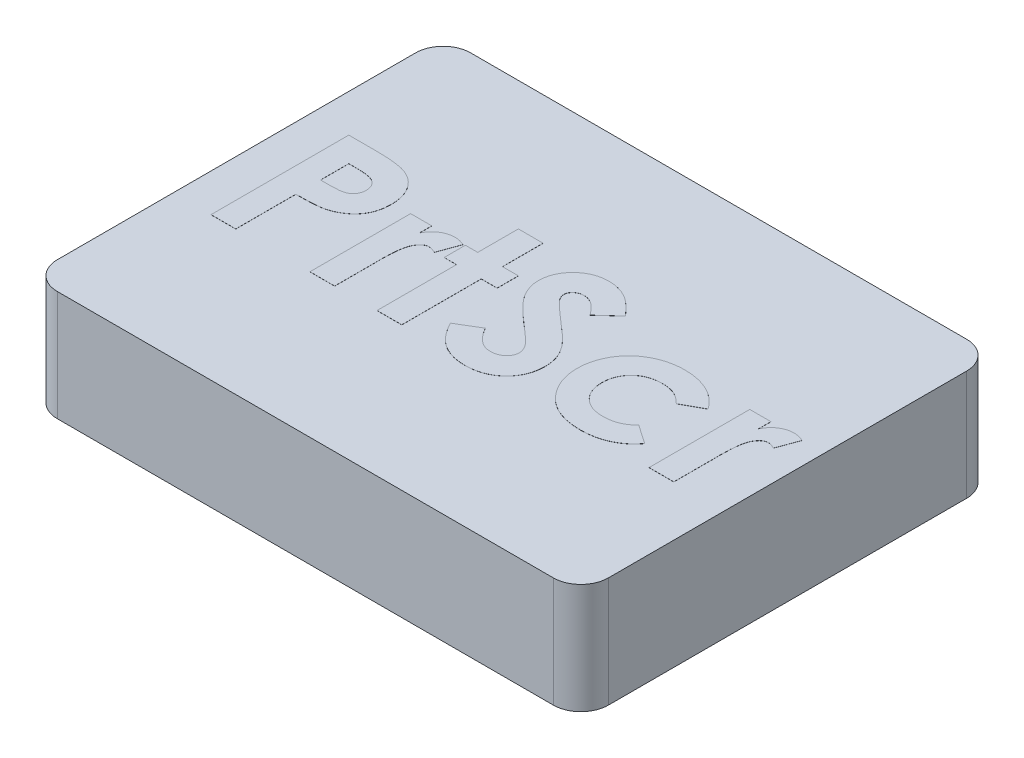
from build123d import *

# Parameters (mm, degrees)
SKETCH1_W           = 12.7
SKETCH1_H           = 9.525
BOSS_EXTRUDE1_DEPTH = 2.54
FILLET1_R           = 0.635
SHELL1_START        = 0.635
SHELL1_OUTLINE_W    = 1.905
SHELL1_OUTLINE_H    = 8.255
SHELL1_DEPTH        = 11.43
SKETCH2_R           = 2.54
BOSS_EXTRUDE2_DEPTH = 1.905
BOSS_EXTRUDE3_DEPTH = 0.00254


# Read off the part's stored shape, not the designer's step: Shell1
with BuildPart() as part:
    # Sketch1 → Boss-Extrude1 (new body)
    with BuildSketch(Plane(origin=(0, 0, 0), x_dir=(1, 0, 0), z_dir=(0, 1, 0))):
        with Locations((6.35, 4.7625)):
            Rectangle(SKETCH1_W, SKETCH1_H)
    extrude(amount=BOSS_EXTRUDE1_DEPTH)

    # Fillet1
    fillet1_edges = [part.edges().sort_by_distance(p)[0] for p in [
        (0, 1.27, -9.525),
        (12.7, 1.27, -9.525),
        (12.7, 1.27, 0),
        (0, 1.27, 0),
    ]]
    fillet(fillet1_edges, radius=FILLET1_R)

    # Shell1 outline → Shell1 (cut)
    with BuildSketch(Plane.YZ.offset(SHELL1_START)):
        with Locations((0.9525, -4.7625)):
            Rectangle(SHELL1_OUTLINE_W, SHELL1_OUTLINE_H)
    extrude(amount=SHELL1_DEPTH, mode=Mode.SUBTRACT)

    # Sketch2 → Boss-Extrude2 (add)
    with BuildSketch(Plane(origin=(0, 1.905, 0), x_dir=(-1, 0, 0), z_dir=(0, -1, 0))):
        with Locations(Location((-6.35, 4.7625, 0), (0, 0, 270))):
            Circle(SKETCH2_R)
    extrude(amount=BOSS_EXTRUDE2_DEPTH)

    # Sketch3 → Boss-Extrude3 (add)
    # profile 1 of 6: a face of its own
    with BuildSketch(Plane(origin=(0, 2.54, 0), x_dir=(1, 0, 0), z_dir=(0, 1, 0))):
        with BuildLine():
            Line((0.874346154, 6.477), (1.510363782, 6.477))
            add(Edge.make_bspline(
                [(1.510363782, 6.477), (1.551920349, 6.476813984), (1.632091677, 6.47645512), (1.747705328, 6.472103418), (1.854364582, 6.464304902), (1.952044933, 6.454667169), (2.040706219, 6.441155443), (2.12045947, 6.425665308), (2.191321237, 6.406793814), (2.25409059, 6.384393613), (2.310424058, 6.35798465), (2.363733687, 6.32985722), (2.412814675, 6.296288125), (2.460144287, 6.260895298), (2.503016608, 6.220297677), (2.544106269, 6.177197093), (2.581673012, 6.129884211), (2.615890906, 6.078931741), (2.646931809, 6.025281068), (2.674051219, 5.968836279), (2.696048965, 5.909508057), (2.714502339, 5.847680187), (2.729324268, 5.783355365), (2.739190216, 5.716137987), (2.745891665, 5.64649739), (2.746482975, 5.599099955), (2.746782051, 5.575127003)],
                knots=[0, 0, 0, 0, 1.698747864, 3.27724071, 4.728299578, 6.070144658, 7.288476769, 8.393259625, 9.389771311, 10.283485332, 11.113357557, 11.931608583, 12.74405601, 13.541433047, 14.344816069, 15.154114104, 15.974336324, 16.810834471, 17.661136416, 18.50621059, 19.367396281, 20.244825668, 21.142564693, 22.063065223, 23.020325768, 24, 24, 24, 24], degree=3))
            add(Edge.make_bspline(
                [(2.746782051, 5.575127003), (2.746349325, 5.548606297), (2.745498965, 5.49648985), (2.737162698, 5.420093533), (2.722921719, 5.347256561), (2.704309504, 5.277364688), (2.678356095, 5.211567789), (2.648705543, 5.148295931), (2.61222596, 5.089323062), (2.570542204, 5.033911502), (2.525018788, 4.98161073), (2.474574986, 4.933930831), (2.42017228, 4.890546773), (2.362125587, 4.851003888), (2.300216983, 4.815381942), (2.234491138, 4.783347374), (2.164499238, 4.755924749), (2.115758985, 4.741582938), (2.091047877, 4.734311699)],
                knots=[0, 0, 0, 0, 1.102006807, 2.165578795, 3.188629044, 4.184801286, 5.166646146, 6.124351954, 7.085497154, 8.042432466, 9.003981491, 9.963833307, 10.922997304, 11.89326795, 12.880200226, 13.889073926, 14.929769137, 16, 16, 16, 16], degree=3))
            add(Edge.make_bspline(
                [(2.091047877, 4.734311699), (2.074771719, 4.730262164), (2.039512321, 4.721489569), (1.981167701, 4.712583183), (1.913931652, 4.704394308), (1.837586757, 4.697356962), (1.752089, 4.692573206), (1.657521166, 4.688837306), (1.553840398, 4.686120921), (1.481744892, 4.686024531), (1.444217949, 4.685974359)],
                knots=[0, 0, 0, 0, 0.618981996, 1.340914327, 2.176866532, 3.120127938, 4.170906482, 5.338178032, 6.614476169, 8, 8, 8, 8], degree=3))
            Line((1.444217949, 4.685974359), (1.444217949, 3.302))
            Line((1.444217949, 3.302), (0.874346154, 3.302))
            Line((0.874346154, 3.302), (0.874346154, 6.477))
        make_face()
        with BuildLine():
            Line((1.444217949, 5.255846154), (1.645835537, 5.255846154))
            add(Edge.make_bspline(
                [(1.645835537, 5.255846154), (1.68252304, 5.256078781), (1.750028591, 5.256506819), (1.842217335, 5.262696491), (1.916301984, 5.272149371), (1.974830231, 5.285706987), (2.021043827, 5.306282464), (2.060900159, 5.330084417), (2.095085953, 5.360181333), (2.124685819, 5.394572209), (2.14835002, 5.434089049), (2.164759911, 5.478088399), (2.175419453, 5.525645784), (2.176403961, 5.558742577), (2.176910256, 5.575763021)],
                knots=[0, 0, 0, 0, 1.8619151, 3.425951444, 4.686033666, 5.651700536, 6.461346321, 7.243864085, 7.999046032, 8.762387399, 9.539336099, 10.322741239, 11.137448474, 12, 12, 12, 12], degree=3))
            add(Edge.make_bspline(
                [(2.176910256, 5.575763021), (2.176409169, 5.590633561), (2.175436938, 5.619485985), (2.168294669, 5.661127188), (2.156911946, 5.69994538), (2.140418817, 5.735535156), (2.119097108, 5.767836043), (2.093101629, 5.796835316), (2.062765954, 5.82315402), (2.03934504, 5.837084912), (2.027446114, 5.84416246)],
                knots=[0, 0, 0, 0, 1.102301479, 2.1387299, 3.123554645, 4.094223062, 5.036071848, 5.982632524, 6.975082478, 8, 8, 8, 8], degree=3))
            add(Edge.make_bspline(
                [(2.027446114, 5.84416246), (2.017367037, 5.849259738), (1.996027566, 5.860051721), (1.959684377, 5.87259819), (1.917744892, 5.883182518), (1.869925973, 5.891967409), (1.816418382, 5.898785396), (1.757231666, 5.903999451), (1.692278727, 5.906096225), (1.647107844, 5.906774724), (1.62357492, 5.907128205)],
                knots=[0, 0, 0, 0, 0.656809284, 1.390599849, 2.23162475, 3.173112763, 4.218524733, 5.370385145, 6.63003504, 8, 8, 8, 8], degree=3))
            Line((1.62357492, 5.907128205), (1.444217949, 5.907128205))
            Line((1.444217949, 5.907128205), (1.444217949, 5.255846154))
        make_face(mode=Mode.SUBTRACT)
    # profile 2 of 6: a face of its own
    with BuildSketch(Plane(origin=(0, 2.54, 0), x_dir=(1, 0, 0), z_dir=(0, 1, 0))):
        with BuildLine():
            Line((3.153833333, 5.622192308), (3.642294872, 5.622192308))
            Line((3.642294872, 5.622192308), (3.642294872, 5.336620393))
            add(Edge.make_bspline(
                [(3.642294872, 5.336620393), (3.656112511, 5.361999247), (3.68311966, 5.411603272), (3.732734058, 5.478186851), (3.789733088, 5.534261684), (3.852068598, 5.581000626), (3.919929516, 5.617429043), (3.991498646, 5.643388882), (4.066163716, 5.66025918), (4.117097696, 5.662011685), (4.142840745, 5.662897436)],
                knots=[0, 0, 0, 0, 1.09866127, 2.147379032, 3.14564304, 4.131443017, 5.102343063, 6.064490016, 7.021754664, 8, 8, 8, 8], degree=3))
            add(Edge.make_bspline(
                [(4.142840745, 5.662897436), (4.161533411, 5.662022129), (4.199598353, 5.660239691), (4.257614682, 5.649878355), (4.316468084, 5.631143087), (4.355198694, 5.614274469), (4.374987179, 5.605655849)],
                knots=[0, 0, 0, 0, 0.931404136, 1.896671404, 2.925354185, 4, 4, 4, 4], degree=3))
            Line((4.374987179, 5.605655849), (4.198174279, 5.12291847))
            add(Edge.make_bspline(
                [(4.198174279, 5.12291847), (4.18236973, 5.130554463), (4.152663263, 5.144907192), (4.109534631, 5.16184489), (4.070393609, 5.172179446), (4.04557892, 5.173721452), (4.034081731, 5.174435897)],
                knots=[0, 0, 0, 0, 1.214386998, 2.282580073, 3.20428172, 4, 4, 4, 4], degree=3))
            add(Edge.make_bspline(
                [(4.034081731, 5.174435897), (4.023226148, 5.173962468), (4.001871347, 5.173031151), (3.970352258, 5.165050083), (3.94066784, 5.151286977), (3.911387601, 5.133655073), (3.884821429, 5.109145407), (3.858271667, 5.080771118), (3.834874594, 5.045739283), (3.810183897, 5.006747072), (3.789160652, 4.959020641), (3.771133866, 4.902045117), (3.755071855, 4.835161255), (3.744018999, 4.758013934), (3.73333597, 4.671349687), (3.726977168, 4.574532411), (3.722237873, 4.467868249), (3.721948097, 4.393412815), (3.721797075, 4.354609175)],
                knots=[0, 0, 0, 0, 0.544232178, 1.070598461, 1.618251235, 2.182094276, 2.777567932, 3.425210017, 4.127676488, 4.886675562, 5.738955394, 6.734782583, 7.883056018, 9.186093582, 10.642914445, 12.264202625, 14.053029461, 16, 16, 16, 16], degree=3))
            Line((3.721797075, 4.354609175), (3.723705128, 4.241398037))
            Line((3.723705128, 4.241398037), (3.723705128, 3.302))
            Line((3.723705128, 3.302), (3.153833333, 3.302))
            Line((3.153833333, 3.302), (3.153833333, 5.622192308))
        make_face()
    # profile 3 of 6: a face of its own
    with BuildSketch(Plane(origin=(0, 2.54, 0), x_dir=(1, 0, 0), z_dir=(0, 1, 0))):
        Polygon((4.700628205, 6.558410256), (5.2705, 6.558410256), (5.2705, 5.622192308), (5.636846154, 5.622192308), (5.636846154, 5.133730769), (5.2705, 5.133730769), (5.2705, 3.302), (4.700628205, 3.302), (4.700628205, 5.133730769), (4.415692308, 5.133730769), (4.415692308, 5.622192308), (4.700628205, 5.622192308), align=None)
    # profile 4 of 6: a face of its own
    with BuildSketch(Plane(origin=(0, 2.54, 0), x_dir=(1, 0, 0), z_dir=(0, 1, 0))):
        with BuildLine():
            Line((7.672102564, 6.052776242), (7.245970753, 5.662897436))
            add(Edge.make_bspline(
                [(7.245970753, 5.662897436), (7.227717094, 5.68864612), (7.192672613, 5.738080004), (7.135869165, 5.804273139), (7.079322213, 5.860740809), (7.022507885, 5.907247119), (6.9649226, 5.943509507), (6.906666318, 5.969183679), (6.84806931, 5.985504993), (6.808701165, 5.98753739), (6.789310096, 5.988538462)],
                knots=[0, 0, 0, 0, 1.299362458, 2.494594718, 3.587462134, 4.587049575, 5.512617175, 6.380583204, 7.202344345, 8, 8, 8, 8], degree=3))
            add(Edge.make_bspline(
                [(6.789310096, 5.988538462), (6.771222663, 5.987904137), (6.736300582, 5.986679422), (6.686516565, 5.974505847), (6.642317605, 5.953496044), (6.603746839, 5.92602396), (6.573193102, 5.892926467), (6.548798312, 5.858215707), (6.535061996, 5.819902879), (6.533254027, 5.793588082), (6.532358974, 5.780560697)],
                knots=[0, 0, 0, 0, 1.185010067, 2.2879431, 3.333075148, 4.379039566, 5.372662701, 6.27520591, 7.14612461, 8, 8, 8, 8], degree=3))
            add(Edge.make_bspline(
                [(6.532358974, 5.780560697), (6.532919858, 5.767345451), (6.5340494, 5.740731783), (6.544959239, 5.701726137), (6.561403481, 5.66361308), (6.577116626, 5.640411849), (6.585148437, 5.628552484)],
                knots=[0, 0, 0, 0, 0.967525499, 1.948461899, 2.951351359, 4, 4, 4, 4], degree=3))
            add(Edge.make_bspline(
                [(6.585148437, 5.628552484), (6.592450223, 5.619334324), (6.60925797, 5.598115336), (6.6413069, 5.564507766), (6.681553625, 5.523335552), (6.731546924, 5.476014485), (6.789211438, 5.420842714), (6.857219991, 5.359989063), (6.933615001, 5.291568965), (6.987914804, 5.243923686), (7.016368389, 5.218957131)],
                knots=[0, 0, 0, 0, 0.473873513, 1.090794244, 1.870441696, 2.795289791, 3.865433203, 5.087734844, 6.473946851, 8, 8, 8, 8], degree=3))
            add(Edge.make_bspline(
                [(7.016368389, 5.218957131), (7.043076172, 5.195842892), (7.093761996, 5.151976869), (7.165877857, 5.089716092), (7.229255688, 5.033701589), (7.28481876, 4.984774018), (7.33172479, 4.942420016), (7.370170971, 4.906437133), (7.400626859, 4.877525888), (7.417939248, 4.860063478), (7.425327724, 4.852610978)],
                knots=[0, 0, 0, 0, 1.543621617, 2.929473131, 4.163658386, 5.240097082, 6.164993805, 6.925417477, 7.541396219, 8, 8, 8, 8], degree=3))
            add(Edge.make_bspline(
                [(7.425327724, 4.852610978), (7.453358062, 4.822276149), (7.507242214, 4.763961956), (7.577272616, 4.673593297), (7.634909903, 4.585375058), (7.679499201, 4.497647272), (7.713174832, 4.4091442), (7.736916598, 4.31769531), (7.751135699, 4.222345018), (7.752714352, 4.157280084), (7.753512821, 4.124370793)],
                knots=[0, 0, 0, 0, 1.206664779, 2.319633467, 3.337109185, 4.282041471, 5.190008762, 6.099243693, 7.03861361, 8, 8, 8, 8], degree=3))
            add(Edge.make_bspline(
                [(7.753512821, 4.124370793), (7.752944491, 4.092304725), (7.751829407, 4.029389906), (7.738171765, 3.93732344), (7.71869677, 3.849211837), (7.688585012, 3.766013874), (7.651884978, 3.686363884), (7.605876186, 3.611502559), (7.551845168, 3.540672272), (7.489917326, 3.475139201), (7.421417779, 3.415672482), (7.347945504, 3.362733804), (7.268782054, 3.319026182), (7.184603787, 3.283036073), (7.095455763, 3.25531601), (7.001444183, 3.2348283), (6.902425252, 3.222531899), (6.83471468, 3.221246456), (6.800122396, 3.220589744)],
                knots=[0, 0, 0, 0, 1.043214005, 2.046824704, 3.02475056, 3.976699089, 4.921714032, 5.875962561, 6.831408892, 7.817874052, 8.806269674, 9.781291748, 10.760897367, 11.74438705, 12.757449933, 13.795994037, 14.874007457, 16, 16, 16, 16], degree=3))
            add(Edge.make_bspline(
                [(6.800122396, 3.220589744), (6.772967748, 3.221071485), (6.719185971, 3.22202561), (6.639919764, 3.229815242), (6.563379279, 3.242386881), (6.489650735, 3.260405794), (6.41840197, 3.283238201), (6.349630059, 3.311127112), (6.283809756, 3.344504794), (6.220443034, 3.382684869), (6.159837934, 3.427016965), (6.101228128, 3.476594728), (6.045195785, 3.532180684), (5.991471791, 3.593643377), (5.940399889, 3.661156853), (5.890308311, 3.733780861), (5.843423279, 3.812863206), (5.814460309, 3.868340111), (5.799666667, 3.896676482)],
                knots=[0, 0, 0, 0, 1.016823716, 2.013894106, 2.979844003, 3.91962641, 4.853723003, 5.779685073, 6.695824784, 7.614987388, 8.547259901, 9.504950863, 10.487499108, 11.500346958, 12.559593716, 13.656357062, 14.802919212, 16, 16, 16, 16], degree=3))
            Line((5.799666667, 3.896676482), (6.300848558, 4.197512821))
            add(Edge.make_bspline(
                [(6.300848558, 4.197512821), (6.319353193, 4.165347337), (6.354828161, 4.103683355), (6.414943809, 4.02082998), (6.476529223, 3.949879779), (6.5410082, 3.892086802), (6.607596701, 3.846678281), (6.676616364, 3.814226202), (6.74811568, 3.794138402), (6.796817766, 3.791685218), (6.821110978, 3.790461538)],
                knots=[0, 0, 0, 0, 1.283663364, 2.460892379, 3.537111102, 4.529833553, 5.449777664, 6.316464042, 7.160231139, 8, 8, 8, 8], degree=3))
            add(Edge.make_bspline(
                [(6.821110978, 3.790461538), (6.845820652, 3.791460861), (6.893761019, 3.793399693), (6.962189757, 3.811308096), (7.024927816, 3.839425604), (7.079158131, 3.879545409), (7.125076942, 3.925849762), (7.15896766, 3.977365473), (7.180258038, 4.033104227), (7.182508947, 4.071824033), (7.183641026, 4.091297877)],
                knots=[0, 0, 0, 0, 1.13588714, 2.203786484, 3.234766741, 4.283437687, 5.291419208, 6.222934724, 7.106237994, 8, 8, 8, 8], degree=3))
            add(Edge.make_bspline(
                [(7.183641026, 4.091297877), (7.182595598, 4.109415119), (7.180471911, 4.146218563), (7.164829488, 4.200939365), (7.14037561, 4.255635282), (7.111444947, 4.300498352), (7.082004376, 4.338060985), (7.053852549, 4.370607307), (7.019571071, 4.406565296), (6.979246865, 4.445980182), (6.933412718, 4.489198947), (6.882030021, 4.536217356), (6.824510388, 4.586621236), (6.783855399, 4.62095586), (6.762597356, 4.638909054)],
                knots=[0, 0, 0, 0, 0.916159276, 1.861089862, 2.860218735, 3.940849679, 4.552606315, 5.27541173, 6.11797699, 7.06649574, 8.129236253, 9.306560635, 10.591630461, 12, 12, 12, 12], degree=3))
            add(Edge.make_bspline(
                [(6.762597356, 4.638909054), (6.72218497, 4.673101808), (6.644621371, 4.738728051), (6.535014163, 4.835655946), (6.436248256, 4.926243946), (6.349176696, 5.011611915), (6.272690058, 5.090183306), (6.207306342, 5.162596305), (6.153743818, 5.22940948), (6.097380811, 5.308545214), (6.043824685, 5.404977544), (5.997536994, 5.520996816), (5.967507494, 5.637001367), (5.964143107, 5.714880433), (5.962487179, 5.753211939)],
                knots=[0, 0, 0, 0, 1.345494975, 2.582412109, 3.71882943, 4.751509156, 5.681369928, 6.505683931, 7.230279997, 7.856715994, 8.973648664, 10.023341002, 11.027102913, 12, 12, 12, 12], degree=3))
            add(Edge.make_bspline(
                [(5.962487179, 5.753211939), (5.963175877, 5.780394586), (5.964532686, 5.83394732), (5.976635629, 5.912688812), (5.994723939, 5.988667736), (6.020993358, 6.061606886), (6.055087892, 6.131414903), (6.09649438, 6.198433526), (6.145855784, 6.262045931), (6.201482755, 6.322209948), (6.262769435, 6.377193012), (6.32826204, 6.425721076), (6.397589878, 6.466708584), (6.470328835, 6.500710699), (6.546929645, 6.526737157), (6.626827992, 6.545186008), (6.710138477, 6.556158796), (6.76680447, 6.55765042), (6.795670272, 6.558410256)],
                knots=[0, 0, 0, 0, 1.010766082, 1.991317756, 2.957454644, 3.913069143, 4.869106762, 5.843196583, 6.838735724, 7.860187025, 8.887984031, 9.89767229, 10.887916223, 11.879572884, 12.879850636, 13.892031539, 14.926195476, 16, 16, 16, 16], degree=3))
            add(Edge.make_bspline(
                [(6.795670272, 6.558410256), (6.833078923, 6.557041768), (6.907600934, 6.554315594), (7.017783876, 6.532997805), (7.125405966, 6.499473336), (7.212129864, 6.459029753), (7.281134451, 6.419852034), (7.334020021, 6.383782126), (7.387833935, 6.342462108), (7.443010169, 6.295761769), (7.498523463, 6.242801214), (7.555952325, 6.18484121), (7.614514218, 6.121380848), (7.652570163, 6.076045059), (7.672102564, 6.052776242)],
                knots=[0, 0, 0, 0, 1.282922637, 2.555718331, 3.837320111, 5.142675274, 5.830281639, 6.55870424, 7.337177975, 8.157850921, 9.037902056, 9.96903443, 10.957596896, 12, 12, 12, 12], degree=3))
        make_face()
    # profile 5 of 6: a face of its own
    with BuildSketch(Plane(origin=(0, 2.54, 0), x_dir=(1, 0, 0), z_dir=(0, 1, 0))):
        with BuildLine():
            Line((10.48075641, 5.148995192), (10.00883133, 4.8895))
            add(Edge.make_bspline(
                [(10.00883133, 4.8895), (9.987200004, 4.911161867), (9.945619158, 4.952801421), (9.878940929, 5.00551049), (9.813454153, 5.049152133), (9.74645908, 5.081357424), (9.677356855, 5.105611095), (9.603655043, 5.121674834), (9.524493415, 5.132252235), (9.469737227, 5.133227763), (9.441503606, 5.133730769)],
                knots=[0, 0, 0, 0, 1.150764855, 2.212059359, 3.192108068, 4.105322427, 5.000809612, 5.941206042, 6.938435785, 8, 8, 8, 8], degree=3))
            add(Edge.make_bspline(
                [(9.441503606, 5.133730769), (9.415611426, 5.133105378), (9.364942602, 5.131881538), (9.290907409, 5.1227403), (9.220544545, 5.108382899), (9.153980315, 5.087377972), (9.091333276, 5.05962932), (9.032085364, 5.026792964), (8.976812314, 4.987586361), (8.926295424, 4.942566822), (8.880695052, 4.893001308), (8.840017194, 4.840137557), (8.806692422, 4.783191348), (8.777881089, 4.723501123), (8.756698646, 4.659945767), (8.741201056, 4.593101977), (8.732367573, 4.522966794), (8.731087758, 4.475052482), (8.730435897, 4.450647837)],
                knots=[0, 0, 0, 0, 1.121765476, 2.195200973, 3.227634963, 4.230038321, 5.213228299, 6.192116585, 7.160777141, 8.14345191, 9.118668839, 10.075979138, 11.027630062, 11.972829041, 12.943187208, 13.923755399, 14.94248691, 16, 16, 16, 16], degree=3))
            add(Edge.make_bspline(
                [(8.730435897, 4.450647837), (8.731124644, 4.426880072), (8.732469471, 4.380471829), (8.740731633, 4.31228706), (8.755075058, 4.24737807), (8.776581146, 4.186088013), (8.802358596, 4.127851883), (8.834730355, 4.073132841), (8.87279776, 4.021691945), (8.916761221, 3.973976291), (8.965461579, 3.931061914), (9.017964384, 3.893164076), (9.074112988, 3.861033721), (9.134561468, 3.835818613), (9.19832427, 3.815273576), (9.265827206, 3.800644704), (9.336998442, 3.792524669), (9.385514071, 3.791159879), (9.410338742, 3.790461538)],
                knots=[0, 0, 0, 0, 1.070556293, 2.090336998, 3.088792742, 4.058148387, 5.011235098, 5.952916408, 6.915475435, 7.888633318, 8.869583867, 9.83422472, 10.800707077, 11.776204622, 12.778807041, 13.814557445, 14.881744048, 16, 16, 16, 16], degree=3))
            add(Edge.make_bspline(
                [(9.410338742, 3.790461538), (9.440903861, 3.791160958), (9.500562533, 3.792526123), (9.587288927, 3.804105012), (9.668897278, 3.823252424), (9.745396239, 3.849753962), (9.816678787, 3.884405217), (9.882561767, 3.92672914), (9.943722453, 3.976413514), (9.979387996, 4.01514857), (9.997383013, 4.034692308)],
                knots=[0, 0, 0, 0, 1.116373375, 2.178998604, 3.189797796, 4.174590301, 5.13072713, 6.078291395, 7.030403691, 8, 8, 8, 8], degree=3))
            Line((9.997383013, 4.034692308), (10.440051282, 3.730675881))
            add(Edge.make_bspline(
                [(10.440051282, 3.730675881), (10.409367644, 3.693161254), (10.348815817, 3.619128988), (10.24316967, 3.523704101), (10.129462507, 3.441712919), (10.00540743, 3.376268597), (9.872811091, 3.324216005), (9.730637379, 3.28741999), (9.579126768, 3.265759744), (9.475071947, 3.262806952), (9.421787059, 3.261294872)],
                knots=[0, 0, 0, 0, 0.997876357, 1.969233105, 2.924898516, 3.881013542, 4.852507933, 5.855329832, 6.901747111, 8, 8, 8, 8], degree=3))
            add(Edge.make_bspline(
                [(9.421787059, 3.261294872), (9.373827356, 3.262403558), (9.280156767, 3.264568944), (9.143634212, 3.281151716), (9.015227659, 3.309083137), (8.894672957, 3.347874142), (8.782080017, 3.398123017), (8.677813988, 3.460450398), (8.581171597, 3.533122564), (8.493896661, 3.616482815), (8.416027393, 3.707221348), (8.348047241, 3.80278345), (8.289254896, 3.901456927), (8.243132359, 4.004884161), (8.205437534, 4.111453062), (8.179979633, 4.22243751), (8.163188579, 4.336923312), (8.161445969, 4.414546076), (8.160564103, 4.453827925)],
                knots=[0, 0, 0, 0, 1.183377041, 2.311265848, 3.387807024, 4.421911742, 5.431260577, 6.423665966, 7.413571885, 8.409103097, 9.395976332, 10.359992013, 11.300391101, 12.225292883, 13.150239058, 14.085544813, 15.031169026, 16, 16, 16, 16], degree=3))
            add(Edge.make_bspline(
                [(8.160564103, 4.453827925), (8.161036525, 4.481195922), (8.161972249, 4.535403508), (8.169960368, 4.61590782), (8.182387199, 4.695046005), (8.201063258, 4.772262556), (8.224031513, 4.847932099), (8.251952538, 4.922039423), (8.285927641, 4.994202122), (8.32382697, 5.065034055), (8.367021651, 5.132665364), (8.414146152, 5.1970662), (8.465134079, 5.257842136), (8.520584411, 5.314426759), (8.580110512, 5.367224953), (8.642847029, 5.417307896), (8.710824083, 5.462092695), (8.781678531, 5.504198679), (8.85602071, 5.541681114), (8.932996158, 5.574033398), (9.012010026, 5.601521328), (9.093251709, 5.623622179), (9.176372498, 5.641837332), (9.262112024, 5.653397417), (9.349760935, 5.661522752), (9.409047411, 5.662436445), (9.438959535, 5.662897436)],
                knots=[0, 0, 0, 0, 1.00272354, 1.986087015, 2.96193297, 3.936200312, 4.894695956, 5.858592327, 6.835334787, 7.815655071, 8.800643866, 9.773423113, 10.738352213, 11.705312252, 12.673769326, 13.65298065, 14.64420052, 15.654211674, 16.672258995, 17.692438602, 18.712115155, 19.735602823, 20.776372304, 21.827874031, 22.90408564, 24, 24, 24, 24], degree=3))
            add(Edge.make_bspline(
                [(9.438959535, 5.662897436), (9.466744061, 5.662583308), (9.52154102, 5.661963782), (9.602463742, 5.655485774), (9.681179057, 5.644482593), (9.757820923, 5.629925848), (9.832622101, 5.611887505), (9.904580056, 5.587842999), (9.974678575, 5.56055339), (10.064966208, 5.51934893), (10.171398803, 5.457844605), (10.288233277, 5.369633843), (10.392405354, 5.266440118), (10.451149526, 5.188351578), (10.48075641, 5.148995192)],
                knots=[0, 0, 0, 0, 0.826738014, 1.630502179, 2.413926014, 3.191023582, 3.95155221, 4.701751672, 5.446919844, 6.189438973, 7.653650558, 9.094719814, 10.535747635, 12, 12, 12, 12], degree=3))
        make_face()
    # profile 6 of 6: a face of its own
    with BuildSketch(Plane(origin=(0, 2.54, 0), x_dir=(1, 0, 0), z_dir=(0, 1, 0))):
        with BuildLine():
            Line((10.969217949, 5.622192308), (11.457679487, 5.622192308))
            Line((11.457679487, 5.622192308), (11.457679487, 5.336620393))
            add(Edge.make_bspline(
                [(11.457679487, 5.336620393), (11.471497126, 5.361999247), (11.498504275, 5.411603272), (11.548118673, 5.478186851), (11.605117703, 5.534261684), (11.667453213, 5.581000626), (11.735314131, 5.617429043), (11.806883261, 5.643388882), (11.881548332, 5.66025918), (11.932482312, 5.662011685), (11.958225361, 5.662897436)],
                knots=[0, 0, 0, 0, 1.09866127, 2.147379032, 3.14564304, 4.131443017, 5.102343063, 6.064490016, 7.021754664, 8, 8, 8, 8], degree=3))
            add(Edge.make_bspline(
                [(11.958225361, 5.662897436), (11.976918026, 5.662022129), (12.014982968, 5.660239691), (12.072999297, 5.649878355), (12.131852699, 5.631143087), (12.170583309, 5.614274469), (12.190371795, 5.605655849)],
                knots=[0, 0, 0, 0, 0.931404136, 1.896671404, 2.925354185, 4, 4, 4, 4], degree=3))
            Line((12.190371795, 5.605655849), (12.013558894, 5.12291847))
            add(Edge.make_bspline(
                [(12.013558894, 5.12291847), (11.997754346, 5.130554463), (11.968047879, 5.144907192), (11.924919247, 5.16184489), (11.885778225, 5.172179446), (11.860963535, 5.173721452), (11.849466346, 5.174435897)],
                knots=[0, 0, 0, 0, 1.214386998, 2.282580073, 3.20428172, 4, 4, 4, 4], degree=3))
            add(Edge.make_bspline(
                [(11.849466346, 5.174435897), (11.838610764, 5.173962468), (11.817255962, 5.173031151), (11.785736873, 5.165050083), (11.756052455, 5.151286977), (11.726772217, 5.133655073), (11.700206045, 5.109145407), (11.673656282, 5.080771118), (11.650259209, 5.045739283), (11.625568513, 5.006747072), (11.604545267, 4.959020641), (11.586518481, 4.902045117), (11.570456471, 4.835161255), (11.559403614, 4.758013934), (11.548720585, 4.671349687), (11.542361783, 4.574532411), (11.537622488, 4.467868249), (11.537332712, 4.393412815), (11.537181691, 4.354609175)],
                knots=[0, 0, 0, 0, 0.544232178, 1.070598461, 1.618251235, 2.182094276, 2.777567932, 3.425210017, 4.127676488, 4.886675562, 5.738955394, 6.734782583, 7.883056018, 9.186093582, 10.642914445, 12.264202625, 14.053029461, 16, 16, 16, 16], degree=3))
            Line((11.537181691, 4.354609175), (11.539089744, 4.241398037))
            Line((11.539089744, 4.241398037), (11.539089744, 3.302))
            Line((11.539089744, 3.302), (10.969217949, 3.302))
            Line((10.969217949, 3.302), (10.969217949, 5.622192308))
        make_face()
    extrude(amount=BOSS_EXTRUDE3_DEPTH)


solid = part.part
